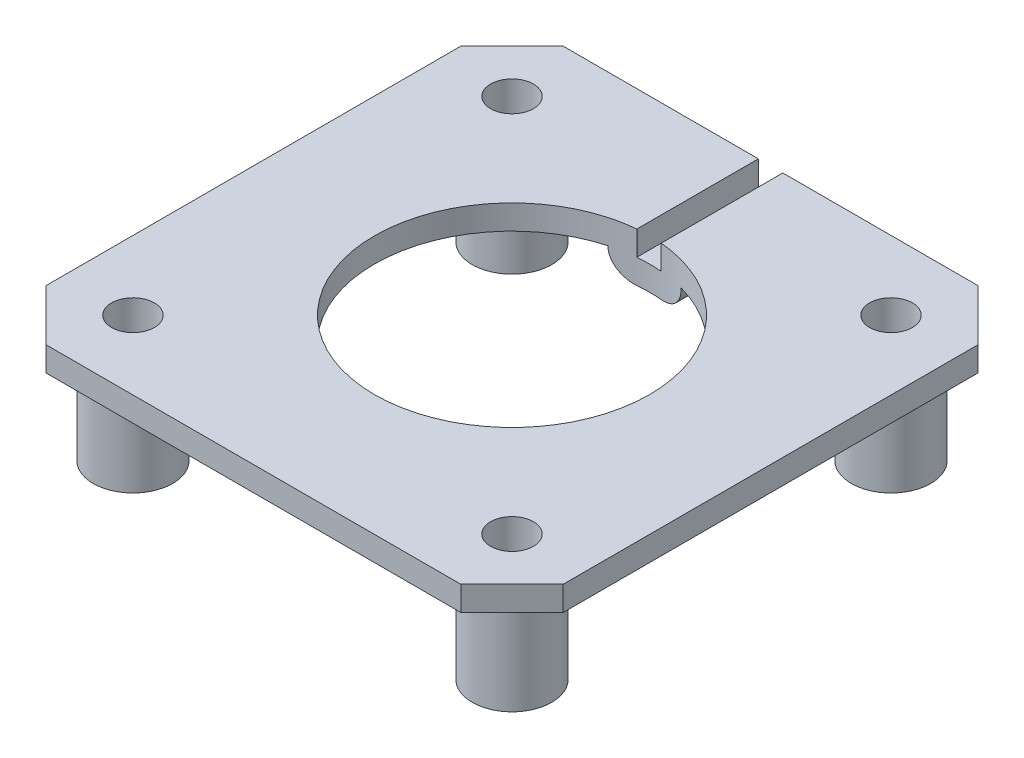
from build123d import *
from build123d.topology import SkipClean

# Parameters (mm, degrees)
SKETCH1_R               = 3.25
BOSS_EXTRUDE1_DEPTH     = 10.3
SKETCH2_W               = 42.3
SKETCH2_H               = 42.3
SKETCH2_R               = 11.25
BOSS_EXTRUDE2_DEPTH     = 2
CUT_EXTRUDE1_DEPTH      = 32.634395837
SKETCH4_R               = 1.75
CUT_EXTRUDE2_DEPTH      = 32.634395837
MIRROR6_COPY_1_SKETCH_R = 1.75
MIRROR6_COPY_1_DEPTH    = 32.634395837
BOSS_EXTRUDE3_DEPTH     = 2
CUT_EXTRUDE3_DEPTH      = 2
FILLET1_R               = 2


with BuildPart() as part:
    # Sketch1 → Boss-Extrude1 (new body)
    with BuildSketch(Plane(origin=(0, 0, 0), x_dir=(1, 0, 0), z_dir=(0, 1, 0))):
        with Locations(Location((-15.5, 15.5, 0), (0, 0, 90))):
            Circle(SKETCH1_R)
    extrude(amount=BOSS_EXTRUDE1_DEPTH)


with BuildPart() as body_2:
    # Mirror2: mirrored copy
    add(part.part.mirror(Plane(origin=(0, 0, 0), x_dir=(0, 0, 1), z_dir=(1, 0, 0))))


with BuildPart() as body_3:
    # Mirror3: mirrored copy
    add(part.part.mirror(Plane.XY))


with BuildPart() as body_4:
    # Mirror3 2: mirrored copy
    add(body_2.part.mirror(Plane.XY))


with BuildPart() as part_1:
    add(part.part)

    add(body_2.part)  # Boss-Extrude2 merges body 2

    add(body_3.part)  # Boss-Extrude2 merges body 3

    add(body_4.part)  # Boss-Extrude2 merges body 4
    # Sketch2 → Boss-Extrude2 (add)
    with BuildSketch(Plane(origin=(0, 10.3, 0), x_dir=(1, 0, 0), z_dir=(0, 1, 0))):
        Rectangle(SKETCH2_W, SKETCH2_H)
        with Locations(Location((0, 0, 0), (0, 0, 270))):
            Circle(SKETCH2_R, mode=Mode.SUBTRACT)
    extrude(amount=-BOSS_EXTRUDE2_DEPTH)

    # Sketch3 → Cut-Extrude1 (cut, through all)
    with BuildSketch(Plane(origin=(0, 10.3, 0), x_dir=(1, 0, 0), z_dir=(0, 1, 0))):
        Polygon((-16.963055506, 21.15), (-21.15, 16.963055506), (-21.15, 21.15), align=None)
        Polygon((16.963055506, -21.15), (21.15, -16.963055506), (21.15, -21.15), align=None)
    cut_extrude1 = extrude(amount=-CUT_EXTRUDE1_DEPTH, mode=Mode.SUBTRACT)

    # Mirror4: Cut-Extrude1 across plane
    add(cut_extrude1.mirror(Plane.XY), mode=Mode.SUBTRACT)

    # Sketch4 → Cut-Extrude2 (cut, through all)
    with BuildSketch(Plane.XZ):
        with Locations(Location((15.5, -15.5, 0), (0, 0, 270))):
            Circle(SKETCH4_R)
    cut_extrude2 = extrude(amount=-CUT_EXTRUDE2_DEPTH, mode=Mode.SUBTRACT)

    # Mirror5: Cut-Extrude2 across plane
    add(cut_extrude2.mirror(Plane(origin=(0, 0, 0), x_dir=(0, 0, 1), z_dir=(1, 0, 0))), mode=Mode.SUBTRACT)

    # Mirror6: Cut-Extrude2 across plane
    add(cut_extrude2.mirror(Plane.XY), mode=Mode.SUBTRACT)

    # Mirror6 copy 1 sketch → Mirror6 copy 1 (cut, through all)
    with BuildSketch(Plane(origin=(0, 0, 0), x_dir=(-1, 0, 0), z_dir=(0, -1, 0))):
        with Locations(Location((15.5, -15.5, 0), (0, 0, 270))):
            Circle(MIRROR6_COPY_1_SKETCH_R)
    extrude(amount=-MIRROR6_COPY_1_DEPTH, mode=Mode.SUBTRACT)

    # Sketch6 → Boss-Extrude3 (add)
    with SkipClean():  # the faces are left unmerged after this step: merging them gives an invalid solid
        with BuildSketch(Plane.XZ.offset(-8.3)):
            with BuildLine():
                Line((-3, -21.15), (-3, -10.842624221))
                ThreePointArc((-3, -10.842624221), (0, -11.25), (3, -10.842624221))
                Line((3, -10.842624221), (3, -21.15))
                Line((3, -21.15), (-3, -21.15))
            make_face()
        extrude(amount=BOSS_EXTRUDE3_DEPTH)

    # Sketch7 → Cut-Extrude3 (cut)
    with SkipClean():  # the faces are left unmerged after this step: merging them gives an invalid solid
        with BuildSketch(Plane(origin=(0, 10.3, 0), x_dir=(1, 0, 0), z_dir=(0, 1, 0))):
            with BuildLine():
                Line((-1, 11.25), (-1, 21.15))
                ThreePointArc((-1, 21.15), (0, 22.15), (1, 21.15))
                Line((1, 21.15), (1, 11.25))
                ThreePointArc((1, 11.25), (0, 10.25), (-1, 11.25))
            make_face()
        extrude(amount=-CUT_EXTRUDE3_DEPTH, mode=Mode.SUBTRACT)

    # Fillet1
    fillet1_edges = [part_1.edges().sort_by_distance(p)[0] for p in [
        (3, 6.3, -15.996312111),
        (-3, 6.3, -15.996312111),
    ]]
    fillet(fillet1_edges, radius=FILLET1_R - 0.0001)  # a hair under: the kernel refuses the full size


solid = part_1.part
